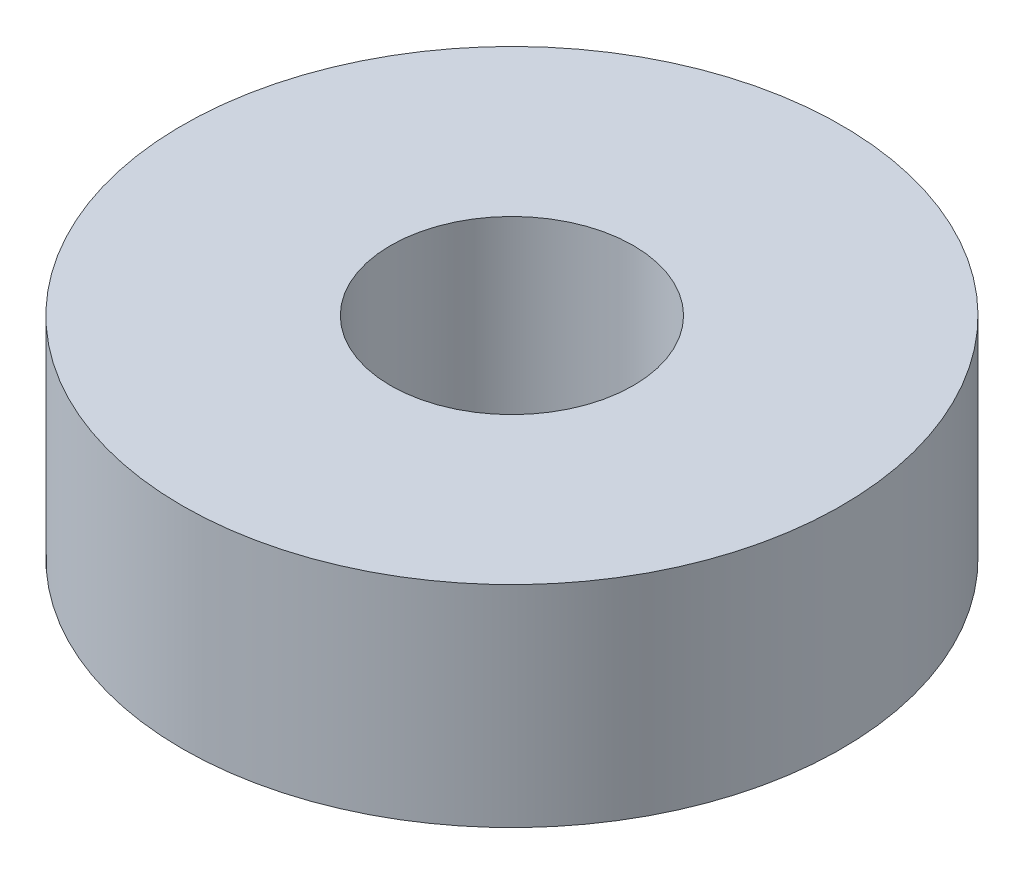
from build123d import *

# Parameters (mm, degrees)
SKETCH1_R           = 10.9625
SKETCH1_R_2         = 4.0375
BOSS_EXTRUDE1_DEPTH = 7


with BuildPart() as part:
    # Sketch1 → Boss-Extrude1 (new body)
    with BuildSketch(Plane(origin=(0, 0, 0), x_dir=(1, 0, 0), z_dir=(0, 1, 0))):
        Circle(SKETCH1_R)
        Circle(SKETCH1_R_2, mode=Mode.SUBTRACT)
    extrude(amount=BOSS_EXTRUDE1_DEPTH)


solid = part.part
